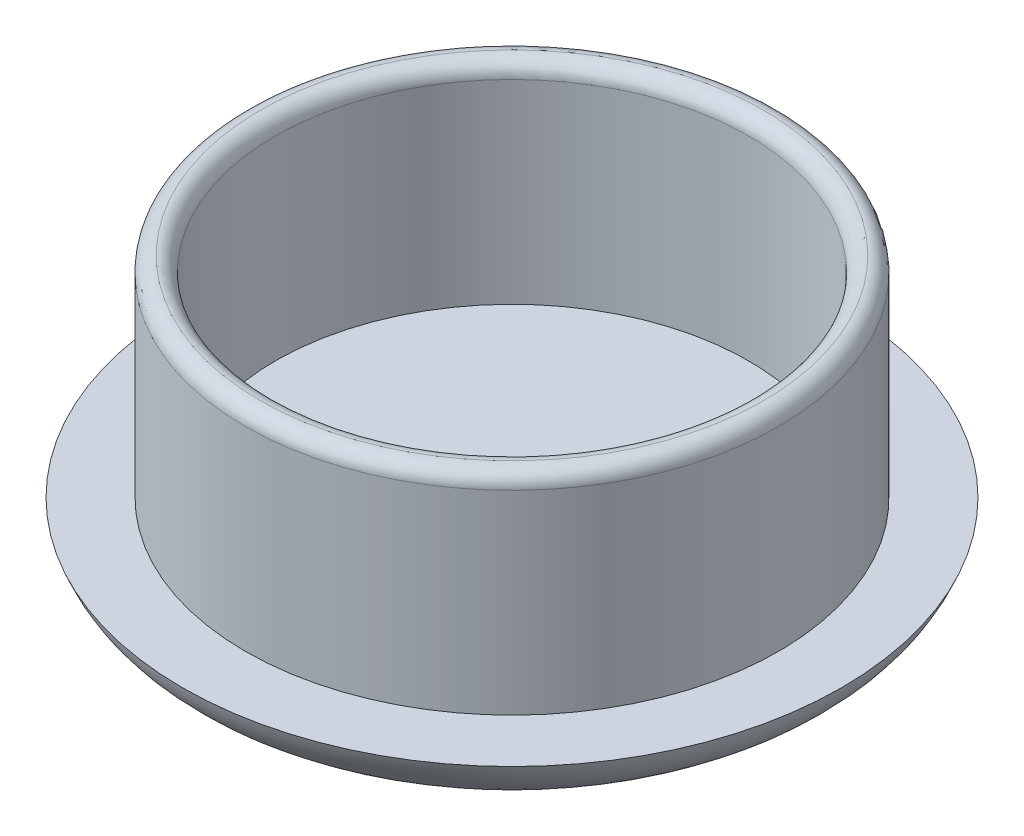
from build123d import *

# Parameters (mm, degrees)
SKETCH1_R           = 11
BOSS_EXTRUDE1_DEPTH = 2
SKETCH2_R           = 8.9
SKETCH2_R_2         = 7.9
BOSS_EXTRUDE2_DEPTH = 7
SKETCH3_R           = 1.65
CUT_EXTRUDE1_DEPTH  = 18.058722109
FILLET1_R           = 3
FILLET2_R           = 0.5


# Some blends are built 0.0001 mm under size
with BuildPart() as part:
    # Sketch1 → Boss-Extrude1 (new body)
    with BuildSketch(Plane(origin=(0, 0, 0), x_dir=(1, 0, 0), z_dir=(0, 1, 0))):
        with Locations(Location((0, 0, 0), (0, 0, 270))):
            Circle(SKETCH1_R)
    extrude(amount=BOSS_EXTRUDE1_DEPTH)

    # Sketch2 → Boss-Extrude2 (add)
    with BuildSketch(Plane(origin=(0, 2, 0), x_dir=(1, 0, 0), z_dir=(0, 1, 0))):
        with Locations(Location((0, 0, 0), (0, 0, 270))):
            Circle(SKETCH2_R)
        with Locations(Location((0, 0, 0), (0, 0, 270))):
            Circle(SKETCH2_R_2, mode=Mode.SUBTRACT)
    extrude(amount=BOSS_EXTRUDE2_DEPTH)

    # Sketch3 → Cut-Extrude1 (cut, through all)
    with BuildSketch(Plane(origin=(0, 2, 0), x_dir=(1, 0, 0), z_dir=(0, 1, 0))):
        with Locations(Location((0, 0, 0), (0, 0, 270))):
            Circle(SKETCH3_R)
    extrude(amount=-CUT_EXTRUDE1_DEPTH, mode=Mode.SUBTRACT)

    # Fillet1
    # the kernel refuses this fillet: 3 mm, written as the material it takes off along each edge
    with BuildSketch(Plane(origin=(0, 0, 0), x_dir=(0, 0, 1), z_dir=(-1, 0, 0))) as fillet1_piece_1:
        with BuildLine():
            CenterArc((8.171572875, 3), FILLET1_R, 270, 70.528779366)
            Line((8.171572875, 0), (8.171572875, -0.06))
            Line((8.171572875, -0.06), (11, -0.06))
            Line((11, -0.06), (11.06, 0))
            ThreePointArc((11.06, 0), (11.06, 1), (11.056568542, 1.98))
            Line((11.056568542, 1.98), (11, 2))
        make_face()
    revolve(axis=Axis((0, 0, 0), (0, 1, 0)), mode=Mode.SUBTRACT)

    # Fillet2
    fillet2_edges = [part.edges().sort_by_distance(p)[0] for p in [
        (0, 9, -8.9),
        (0, 9, -7.9),
    ]]
    fillet(fillet2_edges, radius=FILLET2_R - 0.0001)  # a hair under: the kernel refuses the full size


solid = part.part
